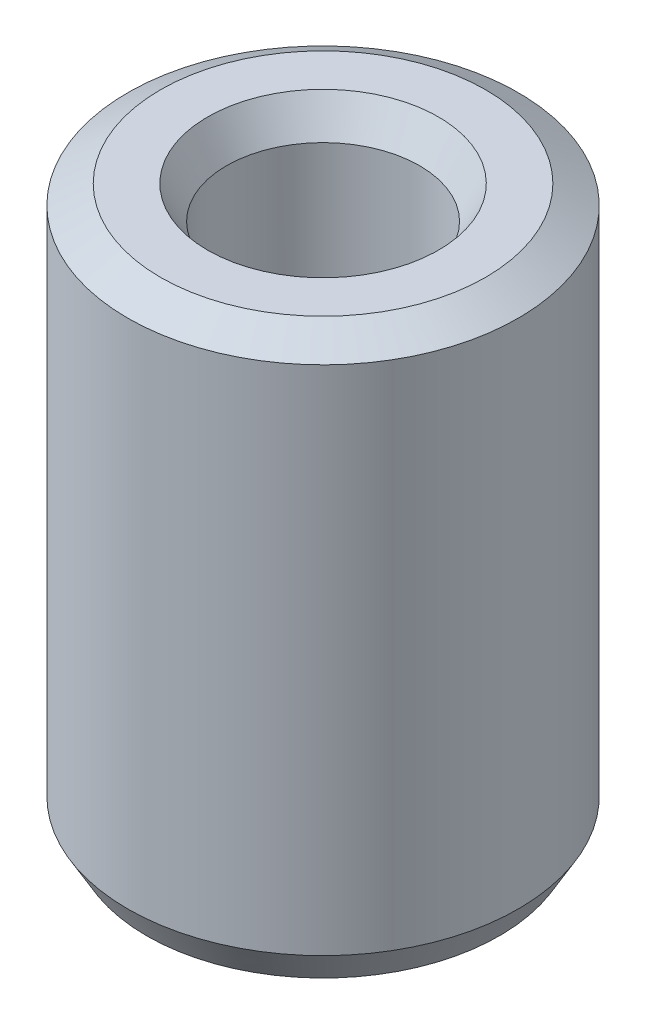
from build123d import *
from OCP.BRepFilletAPI import BRepFilletAPI_MakeChamfer

# Parameters (mm, degrees)
SKETCH1_R           = 15
BOSS_EXTRUDE1_DEPTH = 43.267632495
SKETCH2_R           = 7.413617996
CUT_EXTRUDE1_DEPTH  = 49.188048536
CHAMFER1_SIZE       = 1.453405857
CHAMFER1_SIZE2      = 2.517372789


with BuildPart() as part:
    # Sketch1 → Boss-Extrude1 (new body)
    with BuildSketch(Plane(origin=(0, 0, 0), x_dir=(1, 0, 0), z_dir=(0, 1, 0))):
        Circle(SKETCH1_R)
    extrude(amount=BOSS_EXTRUDE1_DEPTH)

    # Sketch2 → Cut-Extrude1 (cut, through all)
    with BuildSketch(Plane(origin=(0, 0, 0), x_dir=(1, 0, 0), z_dir=(0, 1, 0))):
        Circle(SKETCH2_R)
    extrude(amount=CUT_EXTRUDE1_DEPTH, mode=Mode.SUBTRACT)

    # Chamfer1: one chamfer whose edges measure the first distance from different faces: ONE call of the kernel's chamfer builder (chamfer() names one face for all edges)
    chamfer1_edges_1 = [part.edges().sort_by_distance(p)[0] for p in [
        (-7.413617996, 43.267632495, 0),
    ]]
    chamfer1_side_1 = [part.faces().sort_by_distance(p)[0] for p in [
        (-14.575735931, 43.267632495, 0),
    ]]
    chamfer1_edges_2 = [part.edges().sort_by_distance(p)[0] for p in [
        (-7.413617996, 0, 0),
    ]]
    chamfer1_side_2 = [part.faces().sort_by_distance(p)[0] for p in [
        (-7.413617996, 21.633816248, 0),
    ]]
    chamfer1_edges_3 = [part.edges().sort_by_distance(p)[0] for p in [
        (-15, 0, 0),
    ]]
    chamfer1_side_3 = [part.faces().sort_by_distance(p)[0] for p in [
        (-14.575735931, 0, 0),
    ]]
    chamfer1_edges_4 = [part.edges().sort_by_distance(p)[0] for p in [
        (-15, 43.267632495, 0),
    ]]
    chamfer1_side_4 = [part.faces().sort_by_distance(p)[0] for p in [
        (-15, 21.633816248, 0),
    ]]
    chamfer1 = BRepFilletAPI_MakeChamfer(part.part.solid().wrapped)
    for e in chamfer1_edges_1:
        chamfer1.Add(CHAMFER1_SIZE, CHAMFER1_SIZE2, e.wrapped, chamfer1_side_1[0].wrapped)  # the first distance lies on this face
    for e in chamfer1_edges_2:
        chamfer1.Add(CHAMFER1_SIZE, CHAMFER1_SIZE2, e.wrapped, chamfer1_side_2[0].wrapped)  # the first distance lies on this face
    for e in chamfer1_edges_3:
        chamfer1.Add(CHAMFER1_SIZE, CHAMFER1_SIZE2, e.wrapped, chamfer1_side_3[0].wrapped)  # the first distance lies on this face
    for e in chamfer1_edges_4:
        chamfer1.Add(CHAMFER1_SIZE, CHAMFER1_SIZE2, e.wrapped, chamfer1_side_4[0].wrapped)  # the first distance lies on this face
    add(Compound.cast(chamfer1.Shape()), mode=Mode.REPLACE)


solid = part.part
